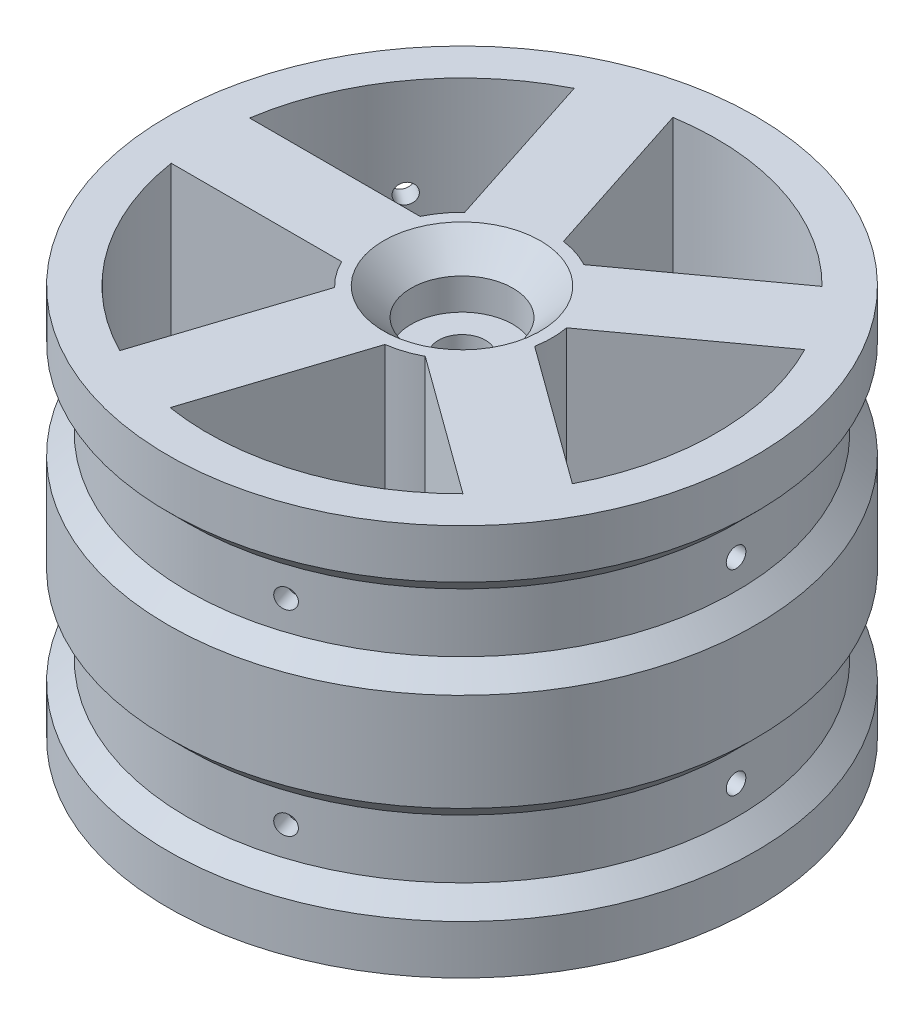
from build123d import *

# Parameters (mm, degrees)
CHAMFER1_SIZE      = 5
CUT_EXTRUDE1_DEPTH = 118.260393996
CIRPATTERN1_COUNT  = 5
CUT_EXTRUDE2_START = 50
SKETCH3_R          = 2.5
CUT_EXTRUDE2_DEPTH = 68.260393996
CIRPATTERN2_COUNT  = 5


with BuildPart() as part:
    # Sketch1 → Revolve1 (revolve)
    with BuildSketch(Plane.XY, mode=Mode.PRIVATE) as revolve1_sk:
        Polygon((20, -50), (75, -50), (75, -32.5), (70, -32.5), (70, -17.5), (75, -17.5), (75, 17.5), (70, 17.5), (70, 32.5), (75, 32.5), (75, 50), (20, 50), (13, 43), (13, 35), (6, 35), (6, -35), (13, -35), (13, -43), align=None)
    revolve(revolve1_sk.sketch.rotate(Axis((0, 0, 0), (0, 1, 0)), 90), axis=Axis((0, 0, 0), (0, 1, 0)))

    # Chamfer1
    chamfer1_edges = [part.edges().sort_by_distance(p)[0] for p in [
        (0, 32.5, 75),
        (0, 17.5, 75),
        (0, -17.5, 75),
        (0, -32.5, 75),
    ]]
    chamfer(chamfer1_edges, length=CHAMFER1_SIZE - 0.0001)  # a hair under: the kernel refuses the full size

    # Sketch2 → Cut-Extrude1 (cut, symmetric)
    with BuildSketch(Plane(origin=(0, 0, 0), x_dir=(1, 0, 0), z_dir=(0, 1, 0))):
        with BuildLine():
            ThreePointArc((23, 0), (22.908434608, -2.050274083), (22.634467494, -4.084223458))
            Line((22.634467494, -4.084223458), (57.837909787, -29.661021416))
            ThreePointArc((57.837909787, -29.661021416), (63.184112466, -15.256733986), (65, 0))
            ThreePointArc((65, 0), (63.184112466, 15.256733986), (57.837909787, 29.661021416))
            Line((57.837909787, 29.661021416), (22.634467494, 4.084223458))
            ThreePointArc((22.634467494, 4.084223458), (22.908434608, 2.050274083), (23, 0))
        make_face()
    cut_extrude1 = extrude(amount=CUT_EXTRUDE1_DEPTH, both=True, mode=Mode.SUBTRACT)

    # CirPattern1: Cut-Extrude1 ×5 about axis
    cirpattern1_axis = Axis((0, 0, 0), (0, 1, 0))
    for i in range(1, CIRPATTERN1_COUNT):
        add(cut_extrude1.rotate(cirpattern1_axis, i * 360 / CIRPATTERN1_COUNT), mode=Mode.SUBTRACT)

    # Sketch3 → Cut-Extrude2 (cut, through all)
    with BuildSketch(Plane(origin=(0, 0, 0), x_dir=(0, 0, -1), z_dir=(1, 0, 0)).offset(CUT_EXTRUDE2_START)):
        with Locations(Location((0, 25, 0), (0, 0, 180))):
            Circle(SKETCH3_R)
        with Locations(Location((0, -25, 0), (0, 0, 180))):
            Circle(SKETCH3_R)
    cut_extrude2 = extrude(amount=CUT_EXTRUDE2_DEPTH, mode=Mode.SUBTRACT)

    # CirPattern2: Cut-Extrude2 ×5 about axis
    cirpattern2_axis = Axis((0, 55, 0), (0, -1, 0))
    for i in range(1, CIRPATTERN2_COUNT):
        add(cut_extrude2.rotate(cirpattern2_axis, i * 360 / CIRPATTERN2_COUNT), mode=Mode.SUBTRACT)


solid = part.part
